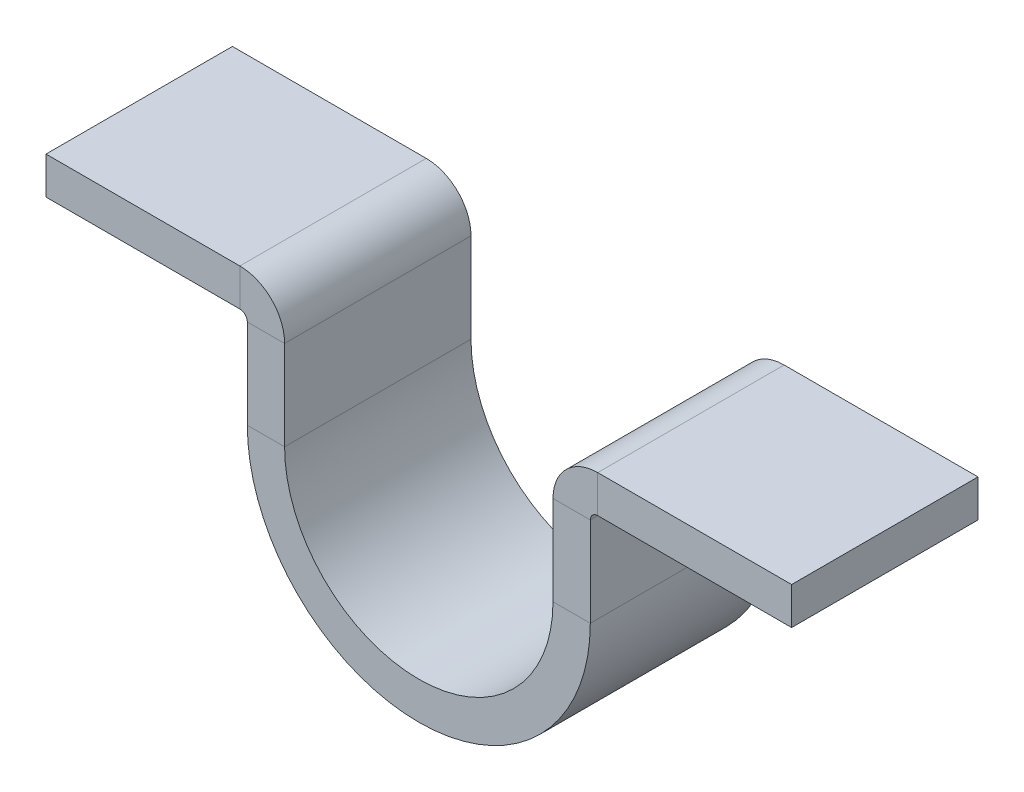
from build123d import *

# Parameters (mm, degrees)
BASE_FLANGE1_DEPTH = 25


# Sheet-metal steps are written as plain solids
with BuildPart() as part:
    # Sketch1 → Base-Flange1 (new body)
    with BuildSketch(Plane.XY):
        with BuildLine():
            Line((-50, 0), (-24, 0))
            ThreePointArc((-24, 0), (-19.757359313, -1.757359313), (-18, -6))
            Line((-18, -6), (-18, -18))
            ThreePointArc((-18, -18), (0, -36), (18, -18))
            Line((18, -18), (18, -6))
            ThreePointArc((18, -6), (19.757359313, -1.757359313), (24, 0))
            Line((24, 0), (50, 0))
            Line((50, 0), (50, -5))
            Line((50, -5), (24, -5))
            ThreePointArc((24, -5), (23.292893219, -5.292893219), (23, -6))
            Line((23, -6), (23, -18))
            ThreePointArc((23, -18), (0, -41), (-23, -18))
            Line((-23, -18), (-23, -6))
            ThreePointArc((-23, -6), (-23.292893219, -5.292893219), (-24, -5))
            Line((-24, -5), (-50, -5))
            Line((-50, -5), (-50, 0))
        make_face()
    extrude(amount=BASE_FLANGE1_DEPTH)


solid = part.part
